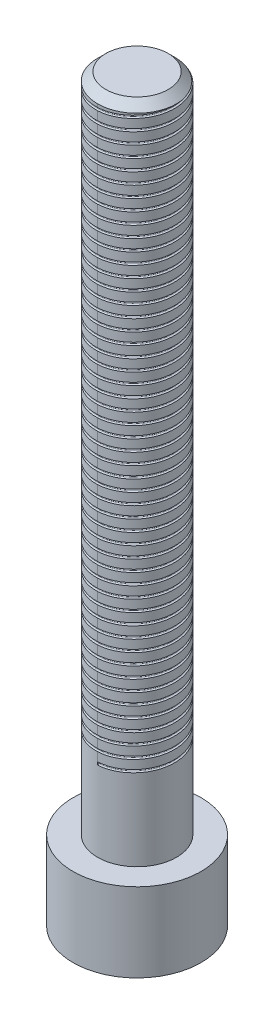
from build123d import *

# Parameters (mm, degrees)
SKETCH1_R              = 3.8749999999999996
BOSS_EXTRUDE1_DEPTH    = 44.78
SKETCH2_OUTSIDE_W      = 18.97
SKETCH2_OUTSIDE_H      = 18.97
SKETCH2_OUTSIDE_R      = 2.39
CUT_EXTRUDE1_DEPTH     = 40
CHAMFER1_SIZE          = 0.5
CUT_SWEEP1_PITCH       = 0.699999999999994
CUT_SWEEP1_HEIGHT      = 34.99999999999981
CUT_SWEEP1_RADIUS      = 2.3900000000000006
CUT_SWEEP1_START_ANGLE = -179.99999999999997
CUT_EXTRUDE2_DEPTH     = 3.36


with BuildPart() as part:
    # Sketch1 → Boss-Extrude1 (new body)
    with BuildSketch(Plane(origin=(0, 0, 0), x_dir=(1, 0, 0), z_dir=(0, 1, 0))):
        with Locations(Location((0, 0, 0), (0, 0, 90))):
            Circle(SKETCH1_R)
    extrude(amount=BOSS_EXTRUDE1_DEPTH)

    # Sketch2 outside → Cut-Extrude1 (cut)
    with BuildSketch(Plane(origin=(0, 44.78, 0), x_dir=(1, 0, 0), z_dir=(0, 1, 0))):
        Rectangle(SKETCH2_OUTSIDE_W, SKETCH2_OUTSIDE_H)
        with Locations(Location((0, 0, 0), (0, 0, 270))):
            Circle(SKETCH2_OUTSIDE_R, mode=Mode.SUBTRACT)
    extrude(amount=-CUT_EXTRUDE1_DEPTH, mode=Mode.SUBTRACT)

    # Chamfer1
    chamfer1_edges = [part.edges().sort_by_distance(p)[0] for p in [
        (7.3e-16, 44.78, -2.39),
    ]]
    chamfer(chamfer1_edges, length=CHAMFER1_SIZE)

    # Cut-Sweep1: sweep along a helix
    with BuildLine() as cut_sweep1_path:
        add(Helix(CUT_SWEEP1_PITCH, CUT_SWEEP1_HEIGHT, CUT_SWEEP1_RADIUS, center=(0, 44.78000000000001, 0), direction=(0, -1, 0), mode=Mode.PRIVATE).rotate(Axis((0, 44.78000000000001, 0), (0, -1, 0)), CUT_SWEEP1_START_ANGLE))
    # Sketch7 → Cut-Sweep1 (sweep, cut)
    with BuildSketch(Plane(origin=(4.3e-16, 44.780000000000015, 2.3900000000000006), x_dir=(0, 0, 1), z_dir=(-0.9989153153619056, -0.046563856535137726, 0))):
        with BuildLine():
            Line((-0.0810235470839768, -0.03025326700835244), (0.5490381056766582, 0.27474232922303093))
            Line((0.5490381056766582, 0.27474232922303093), (0.5490381056766583, -0.4252576707769691))
            Line((0.5490381056766583, -0.4252576707769691), (-0.08102354708397692, -0.12026207454558593))
            ThreePointArc((-0.08102354708397692, -0.12026207454558593), (-0.10923814735316369, -0.07525767077696913), (-0.0810235470839768, -0.03025326700835244))
        make_face()
    sweep(path=cut_sweep1_path.line, is_frenet=True, mode=Mode.SUBTRACT)

    # Sketch8 → Cut-Extrude2 (cut)
    with BuildSketch(Plane.XZ):
        Polygon((2.6442642328884856, 5e-16), (1.3221321164442423, 2.2900000000000005), (-1.322132116444243, 2.29), (-2.6442642328884856, -3e-16), (-1.3221321164442426, -2.2900000000000005), (1.3221321164442432, -2.2900000000000005), align=None)
    extrude(amount=-CUT_EXTRUDE2_DEPTH, mode=Mode.SUBTRACT)


solid = part.part
